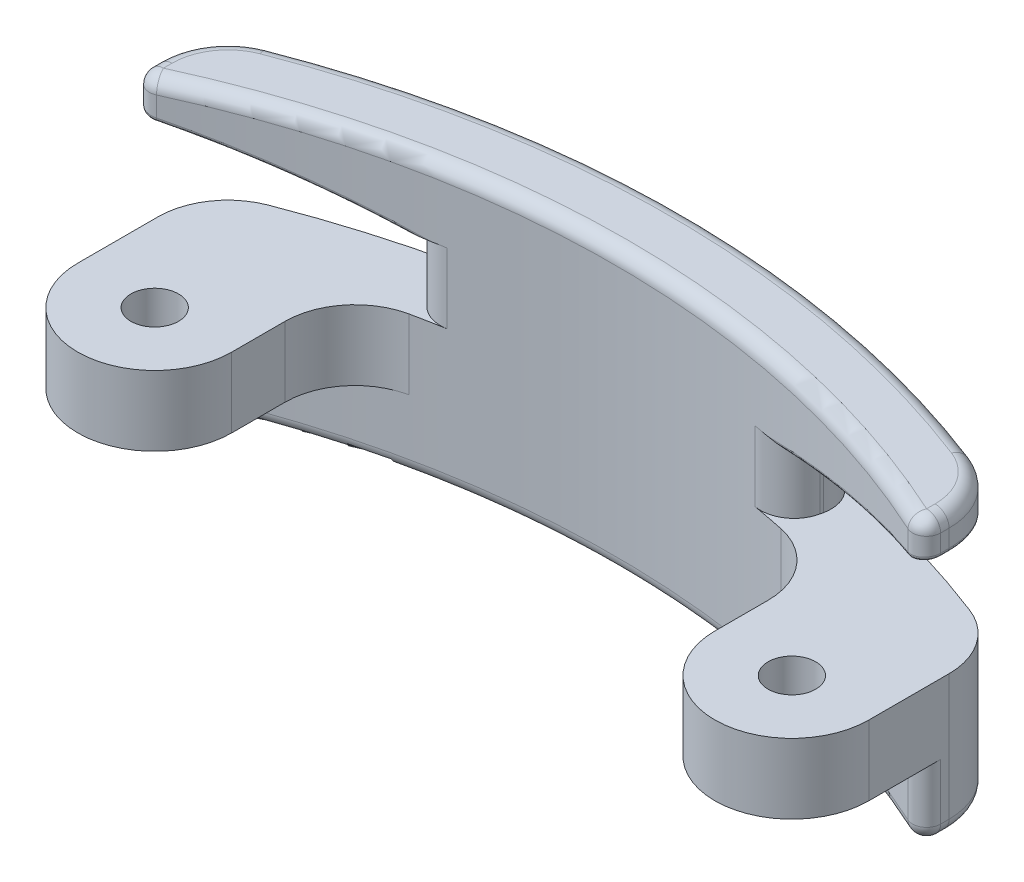
from build123d import *

# Parameters (mm, degrees)
SKETCH1_R               = 1.7
BOSS_EXTRUDE1_DEPTH     = 5
BOSS_EXTRUDE2_DEPTH     = 5
BOSS_EXTRUDE3_START     = 5
BOSS_EXTRUDE3_DEPTH     = 5
CUT_EXTRUDE2_DEPTH      = 10
CUT_EXTRUDE2_DEPTH_BACK = 5
FILLET1_R               = 1
FILLET2_R               = 0.3
CUT_EXTRUDE3_DEPTH      = 5
CUT_EXTRUDE3_DEPTH_BACK = 2


with BuildPart() as part:
    # Sketch1 → Boss-Extrude1 (new body)
    with BuildSketch(Plane(origin=(0, 0, 0), x_dir=(1, 0, 0), z_dir=(0, 1, 0))):
        with BuildLine():
            Line((5.5, 0), (5.5, 3.795724369))
            ThreePointArc((5.5, 3.795724369), (6.616827845, 6.94548214), (9.468389605, 8.688145037))
            ThreePointArc((9.468389605, 8.688145037), (22.75, 10.073189993), (36.031610395, 8.688145037))
            ThreePointArc((36.031610395, 8.688145037), (38.883172155, 6.94548214), (40, 3.795724369))
            Line((40, 3.795724369), (40, 0))
            ThreePointArc((40, 0), (45.5, -5.5), (51, 0))
            Line((51, 0), (51, 5.727869277))
            ThreePointArc((51, 5.727869277), (50.124886671, 8.553698351), (47.805876018, 10.390359149))
            ThreePointArc((47.805876018, 10.390359149), (22.75, 15.073189993), (-2.305876018, 10.390359149))
            ThreePointArc((-2.305876018, 10.390359149), (-4.624886671, 8.553698351), (-5.5, 5.727869277))
            Line((-5.5, 5.727869277), (-5.5, 0))
            ThreePointArc((-5.5, 0), (0, -5.5), (5.5, 0))
        make_face()
        Circle(SKETCH1_R, mode=Mode.SUBTRACT)
        with Locations((45.5, 0)):
            Circle(SKETCH1_R, mode=Mode.SUBTRACT)
    extrude(amount=BOSS_EXTRUDE1_DEPTH)

    # Sketch2 → Boss-Extrude2 (add)
    with BuildSketch(Plane(origin=(0, 5, 0), x_dir=(1, 0, 0), z_dir=(0, 1, 0))):
        with BuildLine():
            Line((8.982118386, 10.994290238), (8.94082737, 11.190113217))
            ThreePointArc((8.94082737, 11.190113217), (9.302312419, 13.031510667), (10.878488445, 14.049884442))
            ThreePointArc((10.878488445, 14.049884442), (22.75, 15.073189993), (34.621511555, 14.049884442))
            ThreePointArc((34.621511555, 14.049884442), (36.197687581, 13.031510667), (36.55917263, 11.190113217))
            Line((36.55917263, 11.190113217), (36.517881614, 10.994290238))
            ThreePointArc((36.517881614, 10.994290238), (35.515850851, 9.502658654), (33.759072817, 9.124820896))
            ThreePointArc((33.759072817, 9.124820896), (22.75, 10.073189993), (11.740927183, 9.124820896))
            ThreePointArc((11.740927183, 9.124820896), (9.984149149, 9.502658654), (8.982118386, 10.994290238))
        make_face()
    extrude(amount=BOSS_EXTRUDE2_DEPTH)

    # Sketch3 → Boss-Extrude3 (add)
    with BuildSketch(Plane(origin=(0, 5, 0), x_dir=(1, 0, 0), z_dir=(0, 1, 0)).offset(BOSS_EXTRUDE3_START)):
        with BuildLine():
            Line((-5.5, 5.122987723), (-5.5, 5.727869277))
            ThreePointArc((-5.5, 5.727869277), (-4.624886671, 8.553698351), (-2.305876018, 10.390359149))
            ThreePointArc((-2.305876018, 10.390359149), (22.75, 15.073189993), (47.805876018, 10.390359149))
            ThreePointArc((47.805876018, 10.390359149), (50.124886671, 8.553698351), (51, 5.727869277))
            Line((51, 5.727869277), (51, 5.122987723))
            ThreePointArc((51, 5.122987723), (50.539982618, 4.281311555), (49.583162455, 4.214006721))
            ThreePointArc((49.583162455, 4.214006721), (22.75, 10.073189993), (-4.083162455, 4.214006721))
            ThreePointArc((-4.083162455, 4.214006721), (-5.039982618, 4.281311555), (-5.5, 5.122987723))
        make_face()
    boss_extrude3 = extrude(amount=BOSS_EXTRUDE3_DEPTH)

    # Mirror1: Boss-Extrude3 across plane
    add(boss_extrude3.mirror(Plane(origin=(-0.5, 5, -5.727869277), x_dir=(0, 0, 1), z_dir=(0, 1, 0))))

    # Sketch6 → Cut-Extrude2 (cut, two sides: drawn at the far end of the back side and taken through both)
    with BuildSketch(Plane.XY.offset(-10.390359149).offset(-CUT_EXTRUDE2_DEPTH_BACK)):
        Polygon((8.982118386, 10), (-5.5, 12.5), (-5.5, 10), align=None)
        Polygon((36.55917263, 10), (51, 12.5), (51, 10), align=None)
    extrude(amount=CUT_EXTRUDE2_DEPTH + CUT_EXTRUDE2_DEPTH_BACK, mode=Mode.SUBTRACT)

    # Fillet1
    fillet1_edges = [part.edges().sort_by_distance(p)[0] for p in [
        (50.124886671, 15, -8.553698351),
        (51, 15, -5.4254285),
        (50.539982618, 15, -4.281311555),
        (22.75, 15, -10.073189993),
        (-5.039982618, 15, -4.281311555),
        (-5.5, 15, -5.4254285),
        (-4.624886671, 15, -8.553698351),
        (50.124886671, -5, -8.553698351),
        (51, -5, -5.4254285),
        (50.539982618, -5, -4.281311555),
        (22.75, -5, -10.073189993),
        (-5.039982618, -5, -4.281311555),
        (-5.5, -5, -5.4254285),
        (-4.624886671, -5, -8.553698351),
        (22.75, 15, -15.073189993),
        (22.75, -5, -15.073189993),
    ]]
    fillet(fillet1_edges, radius=FILLET1_R)

    # Fillet2
    fillet2_edges = [part.edges().sort_by_distance(p)[0] for p in [
        (2.335298559, 11.147418432, -6.750369),
        (-5.036013819, 12.419903607, -4.278778516),
        (-5.5, 12.5, -5.4254285),
        (3.269869553, 10.986086545, -12.28200964),
        (42.250348983, 10.985258013, -12.276090899),
        (43.184744404, 11.147020805, -6.743663152),
        (50.535991482, 12.419670718, -4.278764333),
        (51, 12.5, -5.4254285),
        (-4.618670661, 12.347859043, -8.562750577),
        (50.118635374, 12.347417914, -8.562801843),
    ]]
    fillet(fillet2_edges, radius=FILLET2_R)

    # Sketch7 → Cut-Extrude3 (cut, two sides: drawn at the far end of the back side and taken through both)
    # profile 1 of 5: a face of its own
    with BuildSketch(Plane(origin=(0, 0, -14.049884442), x_dir=(-1, 0, 0), z_dir=(0, 0, -1)).offset(-CUT_EXTRUDE3_DEPTH_BACK)):
        Polygon((-30.052684295, 13.359040702), (-29.961538462, 13.359040702), (-29.961538462, 9.89750224), (-29.384615385, 9.89750224), (-29.384615385, 9.384681727), (-29.961538462, 9.384681727), (-29.961538462, 8.230835573), (-30.41025641, 8.230835573), (-30.41025641, 9.384681727), (-32.782051282, 9.384681727), align=None)
        Polygon((-30.41025641, 9.89750224), (-30.41025641, 12.068976599), (-31.900641026, 9.89750224), align=None, mode=Mode.SUBTRACT)
    # profile 2 of 5: a face of its own
    with BuildSketch(Plane(origin=(0, 0, -14.049884442), x_dir=(-1, 0, 0), z_dir=(0, 0, -1)).offset(-CUT_EXTRUDE3_DEPTH_BACK)):
        Polygon((-28.487179487, 8.230835573), (-28.487179487, 13.230835573), (-28.393028846, 13.230835573), (-25.08974359, 9.295539099), (-25.08974359, 13.230835573), (-24.641025641, 13.230835573), (-24.641025641, 8.230835573), (-24.743189103, 8.230835573), (-28.038461538, 12.157117625), (-28.038461538, 8.230835573), align=None)
    # profile 3 of 5: a face of its own
    with BuildSketch(Plane(origin=(0, 0, -14.049884442), x_dir=(-1, 0, 0), z_dir=(0, 0, -1)).offset(-CUT_EXTRUDE3_DEPTH_BACK)):
        Polygon((-23.487179487, 13.230835573), (-20.41025641, 13.230835573), (-23.038461538, 8.102630445), (-23.426081731, 8.315971791), (-21.169471154, 12.718015061), (-23.487179487, 12.718015061), align=None)
    # profile 4 of 5: a face of its own
    with BuildSketch(Plane(origin=(0, 0, -14.049884442), x_dir=(-1, 0, 0), z_dir=(0, 0, -1)).offset(-CUT_EXTRUDE3_DEPTH_BACK)):
        Polygon((-20.025641026, 11.884681727), (-19.539863782, 11.884681727), (-18.326923077, 9.224425317), (-17.113982372, 11.884681727), (-16.628205128, 11.884681727), (-18.294871795, 8.230835573), (-18.358974359, 8.230835573), align=None)
    # profile 5 of 5: a face of its own
    with BuildSketch(Plane(origin=(0, 0, -14.049884442), x_dir=(-1, 0, 0), z_dir=(0, 0, -1)).offset(-CUT_EXTRUDE3_DEPTH_BACK)):
        with BuildLine():
            Line((-15.538461538, 11.692374035), (-15.987179487, 11.692374035))
            add(Edge.make_bspline(
                [(-15.987179487, 11.692374035), (-15.984254983, 11.751903875), (-15.978511334, 11.868818895), (-15.951613778, 12.039281619), (-15.913126811, 12.202217046), (-15.858710448, 12.356316923), (-15.791130051, 12.50294379), (-15.710087155, 12.641515241), (-15.61409594, 12.771502654), (-15.505229177, 12.891701001), (-15.386988264, 13.00196896), (-15.25940835, 13.097190735), (-15.125344026, 13.177644551), (-14.985202027, 13.244903468), (-14.837401222, 13.295388962), (-14.683282854, 13.332848447), (-14.522169802, 13.355386084), (-14.412398342, 13.357808635), (-14.356570513, 13.359040702)],
                knots=[0, 0, 0, 0, 1.10065271, 2.161652631, 3.183658789, 4.190468796, 5.17591951, 6.163126047, 7.15150782, 8.156236427, 9.156009102, 10.134482811, 11.092018607, 12.041330605, 13.001268258, 13.972401359, 14.968799086, 16, 16, 16, 16], degree=3))
            add(Edge.make_bspline(
                [(-14.356570513, 13.359040702), (-14.301744693, 13.357757192), (-14.194013915, 13.355235143), (-14.036782465, 13.333576529), (-13.887100616, 13.299654256), (-13.74526095, 13.252060804), (-13.612395143, 13.18808305), (-13.48750508, 13.111229424), (-13.369103921, 13.02234395), (-13.262522802, 12.917695645), (-13.164654117, 12.805977953), (-13.080222324, 12.68670952), (-13.007917805, 12.563524826), (-12.947649691, 12.435484538), (-12.903283778, 12.301383069), (-12.869600624, 12.163172779), (-12.850561461, 12.019423049), (-12.847639428, 11.922127969), (-12.846153846, 11.872662497)],
                knots=[0, 0, 0, 0, 1.111607364, 2.184268762, 3.212621178, 4.221274766, 5.211760367, 6.196651075, 7.1921475, 8.207485113, 9.220403448, 10.201281604, 11.166441695, 12.114753415, 13.065576456, 14.026450734, 14.996634279, 16, 16, 16, 16], degree=3))
            add(Edge.make_bspline(
                [(-12.846153846, 11.872662497), (-12.848572793, 11.803022733), (-12.853368238, 11.664965285), (-12.894388776, 11.462086909), (-12.95845522, 11.265524882), (-13.035594301, 11.107328736), (-13.113412079, 10.979852317), (-13.18353709, 10.874897024), (-13.265629677, 10.761889212), (-13.360884674, 10.641207301), (-13.467331634, 10.511906008), (-13.585934725, 10.374063444), (-13.717539699, 10.229103772), (-13.809908986, 10.13009577), (-13.857772436, 10.078792304)],
                knots=[0, 0, 0, 0, 1.184426356, 2.348067706, 3.509069118, 4.696110526, 5.333549288, 6.050745305, 6.844228056, 7.710549037, 8.667450064, 9.695053472, 10.805634456, 12, 12, 12, 12], degree=3))
            Line((-13.857772436, 10.078792304), (-15.108774038, 8.743656086))
            Line((-15.108774038, 8.743656086), (-12.782051282, 8.743656086))
            Line((-12.782051282, 8.743656086), (-12.782051282, 8.230835573))
            Line((-12.782051282, 8.230835573), (-16.179487179, 8.230835573))
            Line((-16.179487179, 8.230835573), (-14.240384615, 10.300146471))
            add(Edge.make_bspline(
                [(-14.240384615, 10.300146471), (-14.193173349, 10.349429766), (-14.102490167, 10.44409289), (-13.974229343, 10.582297118), (-13.859030788, 10.710510748), (-13.756148798, 10.828491532), (-13.667815219, 10.9379652), (-13.589426317, 11.035386205), (-13.52661833, 11.12503542), (-13.458453479, 11.228950582), (-13.392433505, 11.355825321), (-13.335701568, 11.510873449), (-13.301108927, 11.67048381), (-13.296959162, 11.778343863), (-13.294871795, 11.832598394)],
                knots=[0, 0, 0, 0, 1.329631726, 2.553950428, 3.673215718, 4.687767853, 5.603093632, 6.413772471, 7.123043292, 7.734684054, 8.834405432, 9.900288307, 10.943827018, 12, 12, 12, 12], degree=3))
            add(Edge.make_bspline(
                [(-13.294871795, 11.832598394), (-13.295779998, 11.866714677), (-13.297569892, 11.933951321), (-13.313366603, 12.032530977), (-13.337238755, 12.127623568), (-13.371446266, 12.219521595), (-13.416598752, 12.307301098), (-13.471560723, 12.391068927), (-13.5349751, 12.472053163), (-13.608334056, 12.547986446), (-13.688921941, 12.617531025), (-13.774056584, 12.679136861), (-13.864128161, 12.730621305), (-13.958756907, 12.772826301), (-14.057679006, 12.805933989), (-14.161085785, 12.828874816), (-14.268691522, 12.843278365), (-14.342167945, 12.845227182), (-14.379607372, 12.846220189)],
                knots=[0, 0, 0, 0, 0.991446411, 1.95395049, 2.89581595, 3.838931463, 4.798493298, 5.75982156, 6.748411868, 7.785213223, 8.824556874, 9.840280684, 10.836137867, 11.835679398, 12.848801643, 13.863922112, 14.911575587, 16, 16, 16, 16], degree=3))
            add(Edge.make_bspline(
                [(-14.379607372, 12.846220189), (-14.418708561, 12.845198714), (-14.495496842, 12.843192707), (-14.608238317, 12.829160329), (-14.715789428, 12.804951986), (-14.818420718, 12.771842451), (-14.916305841, 12.72975881), (-15.008968761, 12.677342032), (-15.09620146, 12.614794185), (-15.178167922, 12.543879104), (-15.253687892, 12.464925388), (-15.320040571, 12.376911155), (-15.378017735, 12.281443419), (-15.428602354, 12.178779775), (-15.469681911, 12.067988661), (-15.501072126, 11.949463368), (-15.525910478, 11.823718538), (-15.534208365, 11.736882702), (-15.538461538, 11.692374035)],
                knots=[0, 0, 0, 0, 1.031018746, 2.02475058, 2.990194455, 3.934040569, 4.864654155, 5.795059489, 6.735614925, 7.690564532, 8.649604399, 9.611025574, 10.590972636, 11.591080095, 12.624614302, 13.701020113, 14.821632451, 16, 16, 16, 16], degree=3))
        make_face()
    extrude(amount=CUT_EXTRUDE3_DEPTH + CUT_EXTRUDE3_DEPTH_BACK, mode=Mode.SUBTRACT)


solid = part.part
